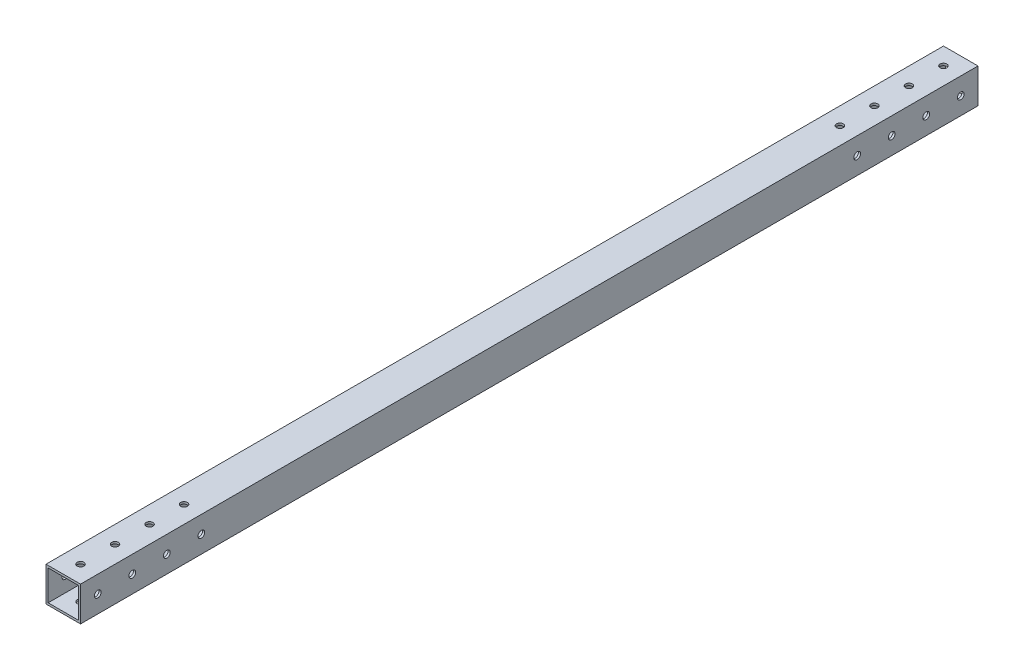
from build123d import *

# Parameters (mm, degrees)
SKETCH5_W           = 25.4
SKETCH5_H           = 25.4
BOSS_EXTRUDE2_DEPTH = 330.2
SHELL3_T            = -1.5875
SKETCH6_R           = 2.4892
CUT_EXTRUDE2_DEPTH  = 333.148099498
SKETCH7_R           = 2.4892
CUT_EXTRUDE3_DEPTH  = 333.148099498


with BuildPart() as part:
    # Sketch5 → Boss-Extrude2 (new, symmetric)
    with BuildSketch(Plane.XY):
        with Locations((12.7, 12.7)):
            Rectangle(SKETCH5_W, SKETCH5_H)
    extrude(amount=BOSS_EXTRUDE2_DEPTH, both=True)

    # Shell3
    shell3_openings = [part.faces().sort_by_distance(p)[0] for p in [
        (12.7, 12.7, 330.2),
        (12.7, 12.7, -330.2),
    ]]
    offset(amount=SHELL3_T, openings=shell3_openings, kind=Kind.INTERSECTION)

    # Sketch6 → Cut-Extrude2 (cut, through all)
    with BuildSketch(Plane(origin=(0, 25.4, 0), x_dir=(1, 0, 0), z_dir=(0, 1, 0))):
        with Locations((12.7, 317.5)):
            Circle(SKETCH6_R)
        with Locations((12.7, 292.1)):
            Circle(SKETCH6_R)
        with Locations((12.7, 266.7)):
            Circle(SKETCH6_R)
        with Locations((12.7, 241.3)):
            Circle(SKETCH6_R)
    cut_extrude2 = extrude(amount=-CUT_EXTRUDE2_DEPTH, mode=Mode.SUBTRACT)

    # Sketch7 → Cut-Extrude3 (cut, through all)
    with BuildSketch(Plane(origin=(25.4, 0, 0), x_dir=(0, 0, -1), z_dir=(1, 0, 0))):
        with Locations((292.1, 12.7)):
            Circle(SKETCH7_R)
        with Locations((317.5, 12.7)):
            Circle(SKETCH7_R)
        with Locations((266.7, 12.7)):
            Circle(SKETCH7_R)
        with Locations((241.3, 12.7)):
            Circle(SKETCH7_R)
    cut_extrude3 = extrude(amount=-CUT_EXTRUDE3_DEPTH, mode=Mode.SUBTRACT)

    # Mirror2: Cut-Extrude2, Cut-Extrude3 across plane
    add(cut_extrude2.mirror(Plane.XY), mode=Mode.SUBTRACT)
    add(cut_extrude3.mirror(Plane.XY), mode=Mode.SUBTRACT)


solid = part.part
